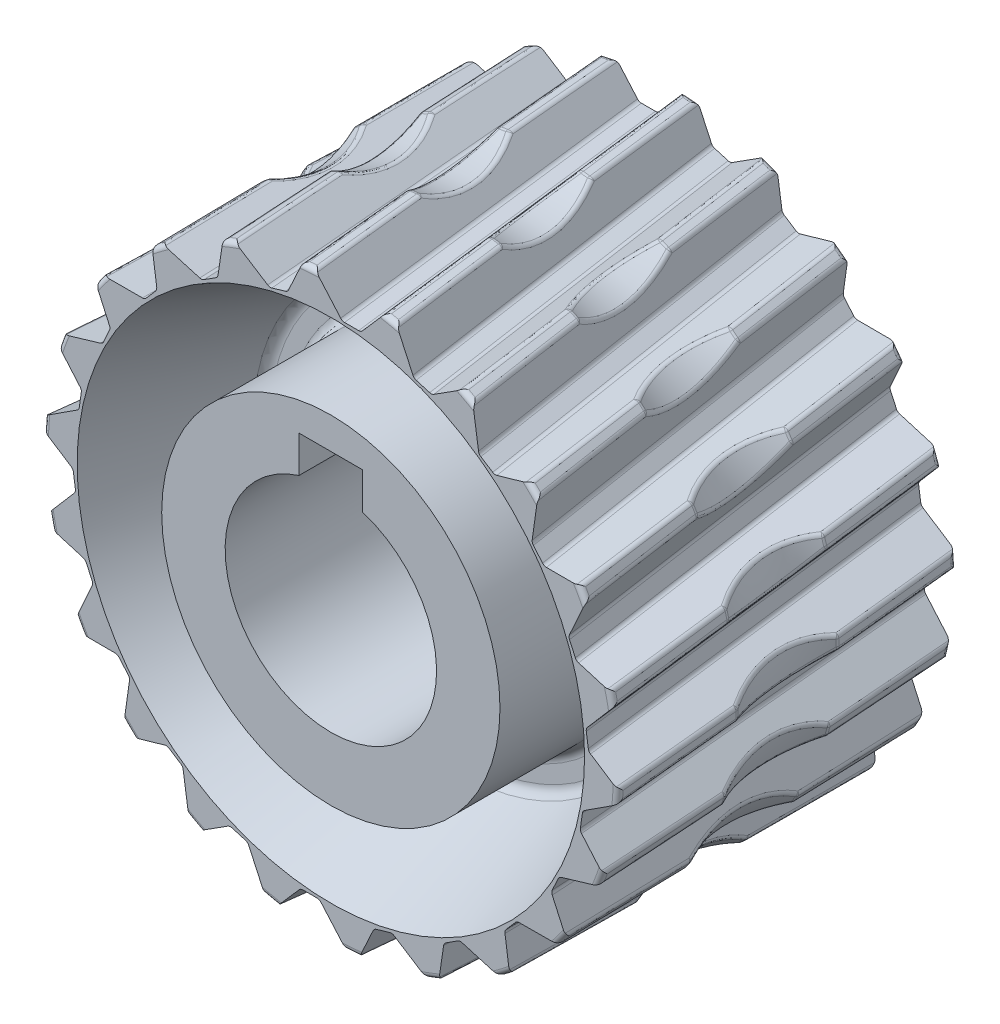
from build123d import *

# Parameters (mm, degrees)
BASE_SKETCH_R              = 28.575
BASE_SKETCH_R_2            = 7.9375
BASE_DEPTH                 = 12.7
GROOVE_SKETCH_R            = 7.9375
OUTER_CHAMFER_SIZE         = 2.54
INNER_FILLET_R             = 0.7874
KEYWAY_DEPTH               = 43.359783404
KEYWAY_DEPTH_BACK          = 43.359783404
KEYWAY_SKETCH_W            = 4.7752
KEYWAY_SKETCH_H            = 10.3251
REVOLVED_FILLET_R          = 0.381
GEARS_COUNT                = 22
REVOLVED_FILLET_OF_GEARS_R = 0.381
GROOVE_FILLET_R            = 0.381


with BuildPart() as part:
    # Base Sketch → Base (new, symmetric)
    with BuildSketch(Plane.XY):
        Circle(BASE_SKETCH_R)
        Circle(BASE_SKETCH_R_2, mode=Mode.SUBTRACT)
    extrude(amount=BASE_DEPTH, both=True)

    # Groove Sketch → Groove (revolve, cut)
    with BuildSketch(Plane(origin=(0, 0, 0), x_dir=(0, 0, -1), z_dir=(1, 0, 0))):
        with Locations((0, 28.575)):
            Circle(GROOVE_SKETCH_R)
    revolve(axis=Axis((0, 0, 0), (0, 0, -1)), mode=Mode.SUBTRACT)

    # Revolved Sketch → Inner Revolved Cut (revolve, cut)
    with BuildSketch(Plane(origin=(0, 0, 0), x_dir=(0, 0, -1), z_dir=(1, 0, 0))):
        Polygon((12.7, 12.7), (2.54, 12.7), (2.54, 15.24), (12.7, 19.05), align=None)
        Polygon((-12.7, 19.05), (-12.7, 12.7), (-2.54, 12.7), (-2.54, 15.24), align=None)
    revolve(axis=Axis((0, 0, 0), (0, 0, -1)), mode=Mode.SUBTRACT)

    # Outer Chamfer
    outer_chamfer_edges = [part.edges().sort_by_distance(p)[0] for p in [
        (-28.575, 0, -12.7),
        (-28.575, 0, 12.7),
    ]]
    chamfer(outer_chamfer_edges, length=OUTER_CHAMFER_SIZE)

    # Inner Fillet
    inner_fillet_edges = [part.edges().sort_by_distance(p)[0] for p in [
        (0, -15.24, -2.54),
        (0, -12.7, -2.54),
        (0, -12.7, 2.54),
        (0, -15.24, 2.54),
    ]]
    fillet(inner_fillet_edges, radius=INNER_FILLET_R)

    # Keyway Sketch → Keyway (cut, two sides: drawn at the far end of the back side and taken through both)
    with BuildSketch(Plane.XY.offset(-KEYWAY_DEPTH_BACK)):
        with Locations((0, 5.16255)):
            Rectangle(KEYWAY_SKETCH_W, KEYWAY_SKETCH_H)
    extrude(amount=KEYWAY_DEPTH + KEYWAY_DEPTH_BACK, mode=Mode.SUBTRACT)

    # Triangle Cut: sweep along a path in Path
    with BuildLine(Plane(origin=(0, 24.13, 0), x_dir=(1, 0, 0), z_dir=(0, 1, 0))) as triangle_cut_path:
        Line((1.949204904, -15.875), (-1.949204904, 15.875))
    # Sketch3 → Triangle Cut (sweep, cut)
    with BuildSketch(Plane(origin=(1.949204904, 24.13, 15.875), x_dir=(-0.9925461516413229, 0, 0.12186934340514129), z_dir=(-0.12186934340514129, 0, -0.9925461516413229))):
        Polygon((0.6985, -4.9022), (-0.6985, -4.9022), (-4.947073333, 0), (4.947073333, 0), align=None)
    triangle_cut = sweep(path=triangle_cut_path.line, mode=Mode.SUBTRACT)

    # Revolve Sketch → Revolve Cut (revolve, cut)
    with BuildSketch(Plane(origin=(0, 0, 0), x_dir=(0, 0, -1), z_dir=(1, 0, 0))):
        Polygon((7.9375, 28.575), (12.7, 28.575), (12.7, 21.59), (-12.7, 21.59), (-12.7, 28.575), align=None)
    revolve(axis=Axis((0, 0, 0), (0, 0, 1)), mode=Mode.SUBTRACT)

    # Revolved Fillet
    revolved_fillet_edges = [part.edges().sort_by_distance(p)[0] for p in [
        (-0.703745613, 19.2278, 0),
        (0.703745613, 19.2278, 0),
    ]]
    fillet(revolved_fillet_edges, radius=REVOLVED_FILLET_R)

    # Gears: Triangle Cut ×22 about axis
    gears_axis = Axis((0, 0, -12.7), (0, 0, 1))
    for i in range(1, GEARS_COUNT):
        add(triangle_cut.rotate(gears_axis, i * 360 / GEARS_COUNT), mode=Mode.SUBTRACT)

    # Revolved Fillet of Gears
    revolved_fillet_of_gears_edges = [part.edges().sort_by_distance(p)[0] for p in [
        (-6.092336227, 18.250670947, 0),
        (-4.741858285, 18.647207049, 0),
        (-10.987361993, 15.794981075, 0),
        (-9.803305027, 16.555928282, 0),
        (-14.992257034, 12.059675773, 0),
        (-14.070546297, 13.123386668, 0),
        (-17.782568573, 7.347367261, 0),
        (-17.197875587, 8.627666313, 0),
        (-19.132242163, 2.03981875, 0),
        (-18.931935277, 3.432983745, 0),
        (-18.931935277, -3.432983745, 0),
        (-19.132242163, -2.03981875, 0),
        (-17.197875587, -8.627666313, 0),
        (-17.782568573, -7.347367261, 0),
        (-14.070546297, -13.123386668, 0),
        (-14.992257034, -12.059675773, 0),
        (-9.803305027, -16.555928282, 0),
        (-10.987361993, -15.794981075, 0),
        (-4.741858285, -18.647207049, 0),
        (-6.092336227, -18.250670947, 0),
        (0.703745613, -19.2278, 0),
        (-0.703745613, -19.2278, 0),
        (6.092336227, -18.250670947, 0),
        (4.741858285, -18.647207049, 0),
        (10.987361993, -15.794981075, 0),
        (9.803305027, -16.555928282, 0),
        (14.992257034, -12.059675773, 0),
        (14.070546297, -13.123386668, 0),
        (17.782568573, -7.347367261, 0),
        (17.197875587, -8.627666313, 0),
        (19.132242163, -2.03981875, 0),
        (18.931935277, -3.432983745, 0),
        (18.931935277, 3.432983745, 0),
        (19.132242163, 2.03981875, 0),
        (17.197875587, 8.627666313, 0),
        (17.782568573, 7.347367261, 0),
        (14.070546297, 13.123386668, 0),
        (14.992257034, 12.059675773, 0),
        (9.803305027, 16.555928282, 0),
        (10.987361993, 15.794981075, 0),
        (4.741858285, 18.647207049, 0),
        (6.092336227, 18.250670947, 0),
    ]]
    fillet(revolved_fillet_of_gears_edges, radius=REVOLVED_FILLET_OF_GEARS_R)

    # Groove Fillet
    groove_fillet_edges = [part.edges().sort_by_distance(p)[0] for p in [
        (3.524552252, 21.300366932, 8.234688654),
        (2.619223715, 21.430533524, -8.234688669),
        (4.435679921, 21.129430746, 8.235570239),
        (4.472041613, 21.121764694, 12.7),
        (1.696844796, 21.523215785, -8.235570543),
        (1.659796267, 21.526104533, -12.7),
        (-3.524552252, 21.300366932, -8.234688654),
        (-2.619223749, 21.43053352, 8.234688354),
        (-4.435679956, 21.129430738, -8.235570554),
        (-4.472041613, 21.121764694, -12.7),
        (-1.696844796, 21.523215785, 8.235570543),
        (-1.659796267, 21.526104533, 12.7),
        (-9.382789959, 19.444571288, -8.234688669),
        (-7.691901307, 20.17331788, 8.235570239),
        (-8.550805755, 19.824525743, 8.234688669),
        (-10.208852298, 19.023864874, -8.235570554),
        (-10.241581278, 19.006265097, -12.7),
        (-7.657167324, 20.186527402, 12.7),
        (-14.480889825, 16.01349212, -8.234688669),
        (-13.063805655, 17.18909776, 8.235570554),
        (-13.789652393, 16.612452765, 8.234688354),
        (-15.154964141, 15.377098618, -8.235570554),
        (-15.181408937, 15.350990935, -12.7),
        (-13.034200224, 17.211557876, 12.7),
        (-18.405834117, 11.285095057, -8.234688669),
        (-17.377358218, 12.812319125, 8.235570239),
        (-17.911343354, 12.054537705, 8.234688669),
        (-18.873310919, 10.484571282, -8.235570554),
        (-18.891329131, 10.452070784, -12.7),
        (-17.35527974, 12.842210291, 12.7),
        (-20.839647194, 5.642446707, -8.234688669),
        (-20.283100524, 7.397562649, 8.235570554),
        (-20.581963835, 6.520035636, 8.234688354),
        (-21.06265429, 4.742646335, -8.235570554),
        (-21.070786189, 4.706386019, -12.7),
        (-20.270337706, 7.432463204, 12.7),
        (-21.585155993, -0.457319118, -8.234688669),
        (-21.545626677, 1.383499576, 8.235570239),
        (-21.585155993, 0.457319118, 8.234688669),
        (-21.545626675, -1.383499612, -8.235570554),
        (-21.543213464, -1.420582151, -12.7),
        (-21.543213464, 1.420582151, 12.7),
        (-20.581963825, -6.520035668, -8.234688669),
        (-21.06265429, -4.742646335, 8.235570554),
        (-20.839647185, -5.64244674, 8.234688354),
        (-20.283100524, -7.397562649, -8.235570554),
        (-20.270337706, -7.432463204, -12.7),
        (-21.070786189, -4.706386019, 12.7),
        (-17.911343354, -12.054537705, -8.234688669),
        (-18.873310901, -10.484571314, 8.235570239),
        (-18.405834117, -11.285095057, 8.234688669),
        (-17.377358196, -12.812319154, -8.235570554),
        (-17.35527974, -12.842210291, -12.7),
        (-18.891329131, -10.452070784, 12.7),
        (-13.789652367, -16.612452787, -8.234688669),
        (-15.154964141, -15.377098618, 8.235570554),
        (-14.480889799, -16.013492143, 8.234688354),
        (-13.063805655, -17.18909776, -8.235570554),
        (-13.034200224, -17.211557876, -12.7),
        (-15.181408937, -15.350990935, 12.7),
        (-8.550805755, -19.824525743, -8.234688669),
        (-10.208852266, -19.023864892, 8.235570239),
        (-9.382789959, -19.444571288, 8.234688669),
        (-7.691901273, -20.173317893, -8.235570554),
        (-7.657167324, -20.186527402, -12.7),
        (-10.241581278, -19.006265097, 12.7),
        (-2.619223715, -21.430533524, -8.234688669),
        (-4.435679956, -21.129430738, 8.235570554),
        (-3.524552219, -21.300366937, 8.234688354),
        (-1.696844795, -21.523215785, -8.235570554),
        (-1.659796267, -21.526104533, -12.7),
        (-4.472041613, -21.121764694, 12.7),
        (3.524552253, -21.300366931, -8.234688669),
        (1.696844831, -21.523215782, 8.235570239),
        (2.619223715, -21.430533524, 8.234688669),
        (4.435679956, -21.129430738, -8.235570554),
        (4.472041613, -21.121764694, -12.7),
        (1.659796267, -21.526104533, 12.7),
        (9.382789959, -19.444571288, -8.234688669),
        (7.691901273, -20.173317893, 8.235570554),
        (8.550805787, -19.824525729, 8.234688354),
        (10.208852298, -19.023864874, -8.235570554),
        (10.241581278, -19.006265097, -12.7),
        (7.657167324, -20.186527402, 12.7),
        (14.480889825, -16.01349212, -8.234688669),
        (13.063805684, -17.189097738, 8.235570239),
        (13.789652367, -16.612452787, 8.234688669),
        (15.154964141, -15.377098618, -8.235570554),
        (15.181408937, -15.350990935, -12.7),
        (13.034200224, -17.211557876, 12.7),
        (18.405834117, -11.285095057, -8.234688669),
        (17.377358196, -12.812319154, 8.235570554),
        (17.911343373, -12.054537676, 8.234688354),
        (18.873310919, -10.484571282, -8.235570554),
        (18.891329131, -10.452070784, -12.7),
        (17.35527974, -12.842210291, 12.7),
        (20.839647194, -5.642446707, -8.234688669),
        (20.283100536, -7.397562614, 8.235570239),
        (20.581963825, -6.520035668, 8.234688669),
        (21.06265429, -4.742646335, -8.235570554),
        (21.070786189, -4.706386019, -12.7),
        (20.270337706, -7.432463204, 12.7),
        (21.585155993, 0.457319118, -8.234688669),
        (21.545626675, -1.383499612, 8.235570554),
        (21.585155993, -0.457319084, 8.234688354),
        (21.545626675, 1.383499612, -8.235570554),
        (21.543213464, 1.420582151, -12.7),
        (21.543213464, -1.420582151, 12.7),
        (20.581963825, 6.520035668, -8.234688669),
        (21.062654282, 4.742646371, 8.235570239),
        (20.839647194, 5.642446707, 8.234688669),
        (20.283100524, 7.397562649, -8.235570554),
        (20.270337706, 7.432463204, -12.7),
        (21.070786189, 4.706386019, 12.7),
        (17.911343354, 12.054537705, -8.234688669),
        (18.873310919, 10.484571282, 8.235570554),
        (18.4058341, 11.285095086, 8.234688354),
        (17.377358196, 12.812319154, -8.235570554),
        (17.35527974, 12.842210291, -12.7),
        (18.891329131, 10.452070784, 12.7),
        (13.789652367, 16.612452787, -8.234688669),
        (15.154964115, 15.377098643, 8.235570239),
        (14.480889825, 16.01349212, 8.234688669),
        (13.063805655, 17.18909776, -8.235570554),
        (13.034200224, 17.211557876, -12.7),
        (15.181408937, 15.350990935, 12.7),
        (8.550805755, 19.824525743, -8.234688669),
        (10.208852298, 19.023864874, 8.235570554),
        (9.382789929, 19.444571303, 8.234688354),
        (7.691901273, 20.173317893, -8.235570554),
        (7.657167324, 20.186527402, -12.7),
        (10.241581278, 19.006265097, 12.7),
        (3.48903085, 21.306214204, 3.770103613),
        (1.868672244, 20.552980229, 0.063624797),
        (2.654953619, 21.426136406, -3.770103613),
        (3.99746579, 20.246905909, -0.063624804),
        (-3.48903085, 21.306214204, -3.770103613),
        (-1.868672244, 20.552980229, -0.063624796),
        (-2.654953619, 21.426136406, 3.770103613),
        (-3.99746579, 20.246905909, 0.063624804),
        (-9.350354791, 19.460189241, -3.770103613),
        (-7.583421543, 19.193974297, -0.063624804),
        (-8.583849534, 19.810240462, 3.770103613),
        (-9.539752908, 18.300547699, 0.063624804),
        (-14.454168594, 16.037615479, -3.770103613),
        (-12.683807141, 16.279986733, -0.063624804),
        (-13.817333012, 16.589436652, 3.770103613),
        (-14.30918598, 14.871587952, 0.063624804),
        (-18.38699162, 11.31576949, -3.770103613),
        (-16.756626118, 12.047091464, -0.063624804),
        (-17.931418343, 12.024655346, 3.770103613),
        (-17.919373904, 10.237820594, 0.063624804),
        (-20.830209937, 5.677187155, -3.770103613),
        (-19.471922903, 6.838212492, -0.063624804),
        (-20.592806803, 6.485707977, 3.770103613),
        (-20.077840725, 4.774645898, 0.063624804),
        (-21.585888526, -0.42132712, -3.770103613),
        (-20.609720297, 1.075342212, -0.063624804),
        (-21.585888526, 0.42132712, 3.770103613),
        (-20.609720297, -1.075342212, 0.063624804),
        (-20.592806803, -6.485707977, -3.770103613),
        (-20.077840725, -4.774645898, -0.063624804),
        (-20.830209937, -5.677187155, 3.770103613),
        (-19.471922903, -6.838212492, 0.063624804),
        (-17.931418343, -12.024655346, -3.770103613),
        (-17.919373904, -10.237820594, -0.063624804),
        (-18.38699162, -11.31576949, 3.770103613),
        (-16.756626118, -12.047091464, 0.063624804),
        (-13.817333012, -16.589436652, -3.770103613),
        (-14.30918598, -14.871587952, -0.063624804),
        (-14.454168594, -16.037615479, 3.770103613),
        (-12.683807141, -16.279986733, 0.063624804),
        (-8.583849534, -19.810240462, -3.770103613),
        (-9.539752908, -18.300547699, -0.063624804),
        (-9.350354791, -19.460189241, 3.770103613),
        (-7.583421543, -19.193974297, 0.063624804),
        (-2.654953617, -21.426136406, -3.770103613),
        (-3.99746579, -20.246905909, -0.063624804),
        (-3.489030852, -21.306214204, 3.770103613),
        (-1.868672232, -20.552980215, 0.063624804),
        (3.489030852, -21.306214204, -3.770103613),
        (1.868672232, -20.552980215, -0.063624804),
        (2.654953617, -21.426136406, 3.770103613),
        (3.99746579, -20.246905909, 0.063624804),
        (9.350354791, -19.460189241, -3.770103613),
        (7.583421543, -19.193974297, -0.063624804),
        (8.583849534, -19.810240462, 3.770103613),
        (9.539752908, -18.300547699, 0.063624804),
        (14.454168594, -16.037615479, -3.770103613),
        (12.683807141, -16.279986733, -0.063624804),
        (13.817333012, -16.589436652, 3.770103613),
        (14.30918598, -14.871587952, 0.063624804),
        (18.38699162, -11.31576949, -3.770103613),
        (16.756626118, -12.047091464, -0.063624804),
        (17.931418343, -12.024655346, 3.770103613),
        (17.919373904, -10.237820594, 0.063624804),
        (20.830209937, -5.677187155, -3.770103613),
        (19.471922903, -6.838212492, -0.063624804),
        (20.592806803, -6.485707977, 3.770103613),
        (20.077840725, -4.774645898, 0.063624804),
        (21.585888526, 0.42132712, -3.770103613),
        (20.609720297, -1.075342212, -0.063624804),
        (21.585888526, -0.42132712, 3.770103613),
        (20.609720297, 1.075342212, 0.063624804),
        (20.592806803, 6.485707977, -3.770103613),
        (20.077840725, 4.774645898, -0.063624804),
        (20.830209937, 5.677187155, 3.770103613),
        (19.471922903, 6.838212492, 0.063624804),
        (17.931418343, 12.024655346, -3.770103613),
        (17.919373904, 10.237820594, -0.063624804),
        (18.38699162, 11.31576949, 3.770103613),
        (16.756626118, 12.047091464, 0.063624804),
        (13.817333012, 16.589436652, -3.770103613),
        (14.30918598, 14.871587952, -0.063624804),
        (14.454168594, 16.037615479, 3.770103613),
        (12.683807141, 16.279986733, 0.063624804),
        (8.583849534, 19.810240462, -3.770103613),
        (9.539752908, 18.300547699, -0.063624804),
        (9.350354791, 19.460189241, 3.770103613),
        (7.583421543, 19.193974297, 0.063624804),
    ]]
    fillet(groove_fillet_edges, radius=GROOVE_FILLET_R)


solid = part.part
